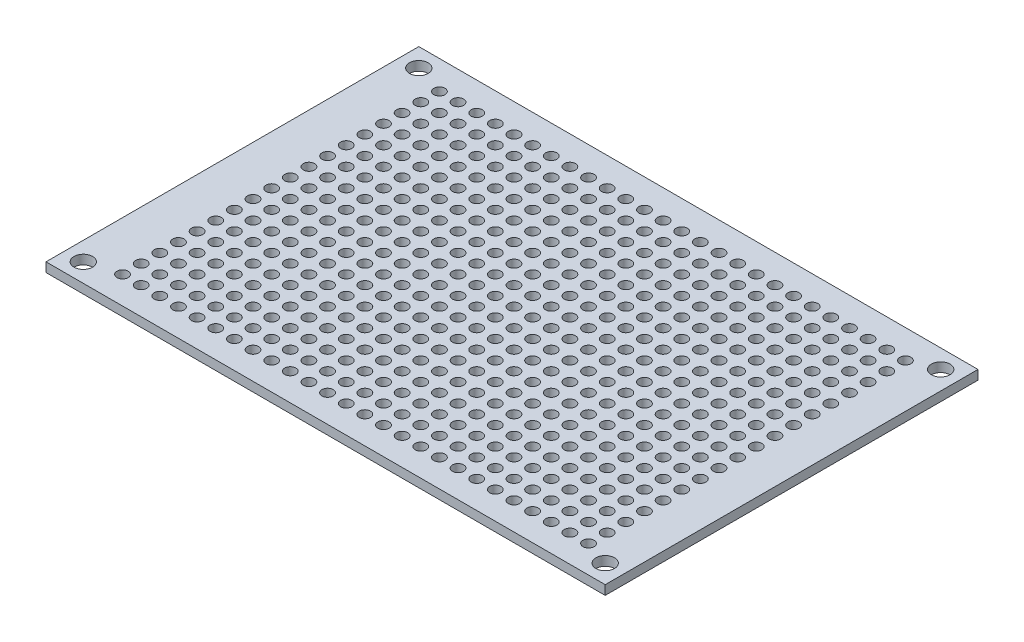
from build123d import *

# Parameters (mm, degrees)
SKETCH1_W           = 60
SKETCH1_H           = 40
SKETCH1_R           = 1
SKETCH1_R_2         = 0.6
BOSS_EXTRUDE1_DEPTH = 1


with BuildPart() as part:
    # Sketch1 → Boss-Extrude1 (new body)
    with BuildSketch(Plane(origin=(0, 0, 0), x_dir=(1, 0, 0), z_dir=(0, 1, 0))):
        Rectangle(SKETCH1_W, SKETCH1_H)
        with Locations((-28, 18)):
            Circle(SKETCH1_R, mode=Mode.SUBTRACT)
        with Locations((28, 18)):
            Circle(SKETCH1_R, mode=Mode.SUBTRACT)
        with Locations((28, -18)):
            Circle(SKETCH1_R, mode=Mode.SUBTRACT)
        with Locations((-28, -18)):
            Circle(SKETCH1_R, mode=Mode.SUBTRACT)
        with Locations((-24.724821281, 16.936286828)):
            Circle(SKETCH1_R_2, mode=Mode.SUBTRACT)
        with Locations((-22.724821281, 16.936286828)):
            Circle(SKETCH1_R_2, mode=Mode.SUBTRACT)
        with Locations((-20.724821281, 16.936286828)):
            Circle(SKETCH1_R_2, mode=Mode.SUBTRACT)
        with Locations((-18.724821281, 16.936286828)):
            Circle(SKETCH1_R_2, mode=Mode.SUBTRACT)
        with Locations((-16.724821281, 16.936286828)):
            Circle(SKETCH1_R_2, mode=Mode.SUBTRACT)
        with Locations((-14.724821281, 16.936286828)):
            Circle(SKETCH1_R_2, mode=Mode.SUBTRACT)
        with Locations((-12.724821281, 16.936286828)):
            Circle(SKETCH1_R_2, mode=Mode.SUBTRACT)
        with Locations((-10.724821281, 16.936286828)):
            Circle(SKETCH1_R_2, mode=Mode.SUBTRACT)
        with Locations((-8.724821281, 16.936286828)):
            Circle(SKETCH1_R_2, mode=Mode.SUBTRACT)
        with Locations((-6.724821281, 16.936286828)):
            Circle(SKETCH1_R_2, mode=Mode.SUBTRACT)
        with Locations((-4.724821281, 16.936286828)):
            Circle(SKETCH1_R_2, mode=Mode.SUBTRACT)
        with Locations((-2.724821281, 16.936286828)):
            Circle(SKETCH1_R_2, mode=Mode.SUBTRACT)
        with Locations((-0.724821281, 16.936286828)):
            Circle(SKETCH1_R_2, mode=Mode.SUBTRACT)
        with Locations((1.275178719, 16.936286828)):
            Circle(SKETCH1_R_2, mode=Mode.SUBTRACT)
        with Locations((3.275178719, 16.936286828)):
            Circle(SKETCH1_R_2, mode=Mode.SUBTRACT)
        with Locations((5.275178719, 16.936286828)):
            Circle(SKETCH1_R_2, mode=Mode.SUBTRACT)
        with Locations((7.275178719, 16.936286828)):
            Circle(SKETCH1_R_2, mode=Mode.SUBTRACT)
        with Locations((9.275178719, 16.936286828)):
            Circle(SKETCH1_R_2, mode=Mode.SUBTRACT)
        with Locations((11.275178719, 16.936286828)):
            Circle(SKETCH1_R_2, mode=Mode.SUBTRACT)
        with Locations((13.275178719, 16.936286828)):
            Circle(SKETCH1_R_2, mode=Mode.SUBTRACT)
        with Locations((15.275178719, 16.936286828)):
            Circle(SKETCH1_R_2, mode=Mode.SUBTRACT)
        with Locations((17.275178719, 16.936286828)):
            Circle(SKETCH1_R_2, mode=Mode.SUBTRACT)
        with Locations((19.275178719, 16.936286828)):
            Circle(SKETCH1_R_2, mode=Mode.SUBTRACT)
        with Locations((21.275178719, 16.936286828)):
            Circle(SKETCH1_R_2, mode=Mode.SUBTRACT)
        with Locations((23.275178719, 16.936286828)):
            Circle(SKETCH1_R_2, mode=Mode.SUBTRACT)
        with Locations((25.275178719, 16.936286828)):
            Circle(SKETCH1_R_2, mode=Mode.SUBTRACT)
        with Locations((-22.724821281, 14.936286828)):
            Circle(SKETCH1_R_2, mode=Mode.SUBTRACT)
        with Locations((-20.724821281, 14.936286828)):
            Circle(SKETCH1_R_2, mode=Mode.SUBTRACT)
        with Locations((-18.724821281, 14.936286828)):
            Circle(SKETCH1_R_2, mode=Mode.SUBTRACT)
        with Locations((-16.724821281, 14.936286828)):
            Circle(SKETCH1_R_2, mode=Mode.SUBTRACT)
        with Locations((-14.724821281, 14.936286828)):
            Circle(SKETCH1_R_2, mode=Mode.SUBTRACT)
        with Locations((-12.724821281, 14.936286828)):
            Circle(SKETCH1_R_2, mode=Mode.SUBTRACT)
        with Locations((-10.724821281, 14.936286828)):
            Circle(SKETCH1_R_2, mode=Mode.SUBTRACT)
        with Locations((-8.724821281, 14.936286828)):
            Circle(SKETCH1_R_2, mode=Mode.SUBTRACT)
        with Locations((-6.724821281, 14.936286828)):
            Circle(SKETCH1_R_2, mode=Mode.SUBTRACT)
        with Locations((-4.724821281, 14.936286828)):
            Circle(SKETCH1_R_2, mode=Mode.SUBTRACT)
        with Locations((-2.724821281, 14.936286828)):
            Circle(SKETCH1_R_2, mode=Mode.SUBTRACT)
        with Locations((-0.724821281, 14.936286828)):
            Circle(SKETCH1_R_2, mode=Mode.SUBTRACT)
        with Locations((1.275178719, 14.936286828)):
            Circle(SKETCH1_R_2, mode=Mode.SUBTRACT)
        with Locations((3.275178719, 14.936286828)):
            Circle(SKETCH1_R_2, mode=Mode.SUBTRACT)
        with Locations((5.275178719, 14.936286828)):
            Circle(SKETCH1_R_2, mode=Mode.SUBTRACT)
        with Locations((7.275178719, 14.936286828)):
            Circle(SKETCH1_R_2, mode=Mode.SUBTRACT)
        with Locations((9.275178719, 14.936286828)):
            Circle(SKETCH1_R_2, mode=Mode.SUBTRACT)
        with Locations((11.275178719, 14.936286828)):
            Circle(SKETCH1_R_2, mode=Mode.SUBTRACT)
        with Locations((13.275178719, 14.936286828)):
            Circle(SKETCH1_R_2, mode=Mode.SUBTRACT)
        with Locations((15.275178719, 14.936286828)):
            Circle(SKETCH1_R_2, mode=Mode.SUBTRACT)
        with Locations((17.275178719, 14.936286828)):
            Circle(SKETCH1_R_2, mode=Mode.SUBTRACT)
        with Locations((19.275178719, 14.936286828)):
            Circle(SKETCH1_R_2, mode=Mode.SUBTRACT)
        with Locations((21.275178719, 14.936286828)):
            Circle(SKETCH1_R_2, mode=Mode.SUBTRACT)
        with Locations((23.275178719, 14.936286828)):
            Circle(SKETCH1_R_2, mode=Mode.SUBTRACT)
        with Locations((25.275178719, 14.936286828)):
            Circle(SKETCH1_R_2, mode=Mode.SUBTRACT)
        with Locations((-22.724821281, 12.936286828)):
            Circle(SKETCH1_R_2, mode=Mode.SUBTRACT)
        with Locations((-20.724821281, 12.936286828)):
            Circle(SKETCH1_R_2, mode=Mode.SUBTRACT)
        with Locations((-18.724821281, 12.936286828)):
            Circle(SKETCH1_R_2, mode=Mode.SUBTRACT)
        with Locations((-16.724821281, 12.936286828)):
            Circle(SKETCH1_R_2, mode=Mode.SUBTRACT)
        with Locations((-14.724821281, 12.936286828)):
            Circle(SKETCH1_R_2, mode=Mode.SUBTRACT)
        with Locations((-12.724821281, 12.936286828)):
            Circle(SKETCH1_R_2, mode=Mode.SUBTRACT)
        with Locations((-10.724821281, 12.936286828)):
            Circle(SKETCH1_R_2, mode=Mode.SUBTRACT)
        with Locations((-8.724821281, 12.936286828)):
            Circle(SKETCH1_R_2, mode=Mode.SUBTRACT)
        with Locations((-6.724821281, 12.936286828)):
            Circle(SKETCH1_R_2, mode=Mode.SUBTRACT)
        with Locations((-4.724821281, 12.936286828)):
            Circle(SKETCH1_R_2, mode=Mode.SUBTRACT)
        with Locations((-2.724821281, 12.936286828)):
            Circle(SKETCH1_R_2, mode=Mode.SUBTRACT)
        with Locations((-0.724821281, 12.936286828)):
            Circle(SKETCH1_R_2, mode=Mode.SUBTRACT)
        with Locations((1.275178719, 12.936286828)):
            Circle(SKETCH1_R_2, mode=Mode.SUBTRACT)
        with Locations((3.275178719, 12.936286828)):
            Circle(SKETCH1_R_2, mode=Mode.SUBTRACT)
        with Locations((5.275178719, 12.936286828)):
            Circle(SKETCH1_R_2, mode=Mode.SUBTRACT)
        with Locations((7.275178719, 12.936286828)):
            Circle(SKETCH1_R_2, mode=Mode.SUBTRACT)
        with Locations((9.275178719, 12.936286828)):
            Circle(SKETCH1_R_2, mode=Mode.SUBTRACT)
        with Locations((11.275178719, 12.936286828)):
            Circle(SKETCH1_R_2, mode=Mode.SUBTRACT)
        with Locations((13.275178719, 12.936286828)):
            Circle(SKETCH1_R_2, mode=Mode.SUBTRACT)
        with Locations((15.275178719, 12.936286828)):
            Circle(SKETCH1_R_2, mode=Mode.SUBTRACT)
        with Locations((17.275178719, 12.936286828)):
            Circle(SKETCH1_R_2, mode=Mode.SUBTRACT)
        with Locations((19.275178719, 12.936286828)):
            Circle(SKETCH1_R_2, mode=Mode.SUBTRACT)
        with Locations((21.275178719, 12.936286828)):
            Circle(SKETCH1_R_2, mode=Mode.SUBTRACT)
        with Locations((23.275178719, 12.936286828)):
            Circle(SKETCH1_R_2, mode=Mode.SUBTRACT)
        with Locations((25.275178719, 12.936286828)):
            Circle(SKETCH1_R_2, mode=Mode.SUBTRACT)
        with Locations((-22.724821281, 10.936286828)):
            Circle(SKETCH1_R_2, mode=Mode.SUBTRACT)
        with Locations((-20.724821281, 10.936286828)):
            Circle(SKETCH1_R_2, mode=Mode.SUBTRACT)
        with Locations((-18.724821281, 10.936286828)):
            Circle(SKETCH1_R_2, mode=Mode.SUBTRACT)
        with Locations((-16.724821281, 10.936286828)):
            Circle(SKETCH1_R_2, mode=Mode.SUBTRACT)
        with Locations((-14.724821281, 10.936286828)):
            Circle(SKETCH1_R_2, mode=Mode.SUBTRACT)
        with Locations((-12.724821281, 10.936286828)):
            Circle(SKETCH1_R_2, mode=Mode.SUBTRACT)
        with Locations((-10.724821281, 10.936286828)):
            Circle(SKETCH1_R_2, mode=Mode.SUBTRACT)
        with Locations((-8.724821281, 10.936286828)):
            Circle(SKETCH1_R_2, mode=Mode.SUBTRACT)
        with Locations((-6.724821281, 10.936286828)):
            Circle(SKETCH1_R_2, mode=Mode.SUBTRACT)
        with Locations((-4.724821281, 10.936286828)):
            Circle(SKETCH1_R_2, mode=Mode.SUBTRACT)
        with Locations((-2.724821281, 10.936286828)):
            Circle(SKETCH1_R_2, mode=Mode.SUBTRACT)
        with Locations((-0.724821281, 10.936286828)):
            Circle(SKETCH1_R_2, mode=Mode.SUBTRACT)
        with Locations((1.275178719, 10.936286828)):
            Circle(SKETCH1_R_2, mode=Mode.SUBTRACT)
        with Locations((3.275178719, 10.936286828)):
            Circle(SKETCH1_R_2, mode=Mode.SUBTRACT)
        with Locations((5.275178719, 10.936286828)):
            Circle(SKETCH1_R_2, mode=Mode.SUBTRACT)
        with Locations((7.275178719, 10.936286828)):
            Circle(SKETCH1_R_2, mode=Mode.SUBTRACT)
        with Locations((9.275178719, 10.936286828)):
            Circle(SKETCH1_R_2, mode=Mode.SUBTRACT)
        with Locations((11.275178719, 10.936286828)):
            Circle(SKETCH1_R_2, mode=Mode.SUBTRACT)
        with Locations((13.275178719, 10.936286828)):
            Circle(SKETCH1_R_2, mode=Mode.SUBTRACT)
        with Locations((15.275178719, 10.936286828)):
            Circle(SKETCH1_R_2, mode=Mode.SUBTRACT)
        with Locations((17.275178719, 10.936286828)):
            Circle(SKETCH1_R_2, mode=Mode.SUBTRACT)
        with Locations((19.275178719, 10.936286828)):
            Circle(SKETCH1_R_2, mode=Mode.SUBTRACT)
        with Locations((21.275178719, 10.936286828)):
            Circle(SKETCH1_R_2, mode=Mode.SUBTRACT)
        with Locations((23.275178719, 10.936286828)):
            Circle(SKETCH1_R_2, mode=Mode.SUBTRACT)
        with Locations((25.275178719, 10.936286828)):
            Circle(SKETCH1_R_2, mode=Mode.SUBTRACT)
        with Locations((-22.724821281, 8.936286828)):
            Circle(SKETCH1_R_2, mode=Mode.SUBTRACT)
        with Locations((-20.724821281, 8.936286828)):
            Circle(SKETCH1_R_2, mode=Mode.SUBTRACT)
        with Locations((-18.724821281, 8.936286828)):
            Circle(SKETCH1_R_2, mode=Mode.SUBTRACT)
        with Locations((-16.724821281, 8.936286828)):
            Circle(SKETCH1_R_2, mode=Mode.SUBTRACT)
        with Locations((-14.724821281, 8.936286828)):
            Circle(SKETCH1_R_2, mode=Mode.SUBTRACT)
        with Locations((-12.724821281, 8.936286828)):
            Circle(SKETCH1_R_2, mode=Mode.SUBTRACT)
        with Locations((-10.724821281, 8.936286828)):
            Circle(SKETCH1_R_2, mode=Mode.SUBTRACT)
        with Locations((-8.724821281, 8.936286828)):
            Circle(SKETCH1_R_2, mode=Mode.SUBTRACT)
        with Locations((-6.724821281, 8.936286828)):
            Circle(SKETCH1_R_2, mode=Mode.SUBTRACT)
        with Locations((-4.724821281, 8.936286828)):
            Circle(SKETCH1_R_2, mode=Mode.SUBTRACT)
        with Locations((-2.724821281, 8.936286828)):
            Circle(SKETCH1_R_2, mode=Mode.SUBTRACT)
        with Locations((-0.724821281, 8.936286828)):
            Circle(SKETCH1_R_2, mode=Mode.SUBTRACT)
        with Locations((1.275178719, 8.936286828)):
            Circle(SKETCH1_R_2, mode=Mode.SUBTRACT)
        with Locations((3.275178719, 8.936286828)):
            Circle(SKETCH1_R_2, mode=Mode.SUBTRACT)
        with Locations((5.275178719, 8.936286828)):
            Circle(SKETCH1_R_2, mode=Mode.SUBTRACT)
        with Locations((7.275178719, 8.936286828)):
            Circle(SKETCH1_R_2, mode=Mode.SUBTRACT)
        with Locations((9.275178719, 8.936286828)):
            Circle(SKETCH1_R_2, mode=Mode.SUBTRACT)
        with Locations((11.275178719, 8.936286828)):
            Circle(SKETCH1_R_2, mode=Mode.SUBTRACT)
        with Locations((13.275178719, 8.936286828)):
            Circle(SKETCH1_R_2, mode=Mode.SUBTRACT)
        with Locations((15.275178719, 8.936286828)):
            Circle(SKETCH1_R_2, mode=Mode.SUBTRACT)
        with Locations((17.275178719, 8.936286828)):
            Circle(SKETCH1_R_2, mode=Mode.SUBTRACT)
        with Locations((19.275178719, 8.936286828)):
            Circle(SKETCH1_R_2, mode=Mode.SUBTRACT)
        with Locations((21.275178719, 8.936286828)):
            Circle(SKETCH1_R_2, mode=Mode.SUBTRACT)
        with Locations((23.275178719, 8.936286828)):
            Circle(SKETCH1_R_2, mode=Mode.SUBTRACT)
        with Locations((25.275178719, 8.936286828)):
            Circle(SKETCH1_R_2, mode=Mode.SUBTRACT)
        with Locations((-22.724821281, 6.936286828)):
            Circle(SKETCH1_R_2, mode=Mode.SUBTRACT)
        with Locations((-20.724821281, 6.936286828)):
            Circle(SKETCH1_R_2, mode=Mode.SUBTRACT)
        with Locations((-18.724821281, 6.936286828)):
            Circle(SKETCH1_R_2, mode=Mode.SUBTRACT)
        with Locations((-16.724821281, 6.936286828)):
            Circle(SKETCH1_R_2, mode=Mode.SUBTRACT)
        with Locations((-14.724821281, 6.936286828)):
            Circle(SKETCH1_R_2, mode=Mode.SUBTRACT)
        with Locations((-12.724821281, 6.936286828)):
            Circle(SKETCH1_R_2, mode=Mode.SUBTRACT)
        with Locations((-10.724821281, 6.936286828)):
            Circle(SKETCH1_R_2, mode=Mode.SUBTRACT)
        with Locations((-8.724821281, 6.936286828)):
            Circle(SKETCH1_R_2, mode=Mode.SUBTRACT)
        with Locations((-6.724821281, 6.936286828)):
            Circle(SKETCH1_R_2, mode=Mode.SUBTRACT)
        with Locations((-4.724821281, 6.936286828)):
            Circle(SKETCH1_R_2, mode=Mode.SUBTRACT)
        with Locations((-2.724821281, 6.936286828)):
            Circle(SKETCH1_R_2, mode=Mode.SUBTRACT)
        with Locations((-0.724821281, 6.936286828)):
            Circle(SKETCH1_R_2, mode=Mode.SUBTRACT)
        with Locations((1.275178719, 6.936286828)):
            Circle(SKETCH1_R_2, mode=Mode.SUBTRACT)
        with Locations((3.275178719, 6.936286828)):
            Circle(SKETCH1_R_2, mode=Mode.SUBTRACT)
        with Locations((5.275178719, 6.936286828)):
            Circle(SKETCH1_R_2, mode=Mode.SUBTRACT)
        with Locations((7.275178719, 6.936286828)):
            Circle(SKETCH1_R_2, mode=Mode.SUBTRACT)
        with Locations((9.275178719, 6.936286828)):
            Circle(SKETCH1_R_2, mode=Mode.SUBTRACT)
        with Locations((11.275178719, 6.936286828)):
            Circle(SKETCH1_R_2, mode=Mode.SUBTRACT)
        with Locations((13.275178719, 6.936286828)):
            Circle(SKETCH1_R_2, mode=Mode.SUBTRACT)
        with Locations((15.275178719, 6.936286828)):
            Circle(SKETCH1_R_2, mode=Mode.SUBTRACT)
        with Locations((17.275178719, 6.936286828)):
            Circle(SKETCH1_R_2, mode=Mode.SUBTRACT)
        with Locations((19.275178719, 6.936286828)):
            Circle(SKETCH1_R_2, mode=Mode.SUBTRACT)
        with Locations((21.275178719, 6.936286828)):
            Circle(SKETCH1_R_2, mode=Mode.SUBTRACT)
        with Locations((23.275178719, 6.936286828)):
            Circle(SKETCH1_R_2, mode=Mode.SUBTRACT)
        with Locations((25.275178719, 6.936286828)):
            Circle(SKETCH1_R_2, mode=Mode.SUBTRACT)
        with Locations((-22.724821281, 4.936286828)):
            Circle(SKETCH1_R_2, mode=Mode.SUBTRACT)
        with Locations((-20.724821281, 4.936286828)):
            Circle(SKETCH1_R_2, mode=Mode.SUBTRACT)
        with Locations((-18.724821281, 4.936286828)):
            Circle(SKETCH1_R_2, mode=Mode.SUBTRACT)
        with Locations((-16.724821281, 4.936286828)):
            Circle(SKETCH1_R_2, mode=Mode.SUBTRACT)
        with Locations((-14.724821281, 4.936286828)):
            Circle(SKETCH1_R_2, mode=Mode.SUBTRACT)
        with Locations((-12.724821281, 4.936286828)):
            Circle(SKETCH1_R_2, mode=Mode.SUBTRACT)
        with Locations((-10.724821281, 4.936286828)):
            Circle(SKETCH1_R_2, mode=Mode.SUBTRACT)
        with Locations((-8.724821281, 4.936286828)):
            Circle(SKETCH1_R_2, mode=Mode.SUBTRACT)
        with Locations((-6.724821281, 4.936286828)):
            Circle(SKETCH1_R_2, mode=Mode.SUBTRACT)
        with Locations((-4.724821281, 4.936286828)):
            Circle(SKETCH1_R_2, mode=Mode.SUBTRACT)
        with Locations((-2.724821281, 4.936286828)):
            Circle(SKETCH1_R_2, mode=Mode.SUBTRACT)
        with Locations((-0.724821281, 4.936286828)):
            Circle(SKETCH1_R_2, mode=Mode.SUBTRACT)
        with Locations((1.275178719, 4.936286828)):
            Circle(SKETCH1_R_2, mode=Mode.SUBTRACT)
        with Locations((3.275178719, 4.936286828)):
            Circle(SKETCH1_R_2, mode=Mode.SUBTRACT)
        with Locations((5.275178719, 4.936286828)):
            Circle(SKETCH1_R_2, mode=Mode.SUBTRACT)
        with Locations((7.275178719, 4.936286828)):
            Circle(SKETCH1_R_2, mode=Mode.SUBTRACT)
        with Locations((9.275178719, 4.936286828)):
            Circle(SKETCH1_R_2, mode=Mode.SUBTRACT)
        with Locations((11.275178719, 4.936286828)):
            Circle(SKETCH1_R_2, mode=Mode.SUBTRACT)
        with Locations((13.275178719, 4.936286828)):
            Circle(SKETCH1_R_2, mode=Mode.SUBTRACT)
        with Locations((15.275178719, 4.936286828)):
            Circle(SKETCH1_R_2, mode=Mode.SUBTRACT)
        with Locations((17.275178719, 4.936286828)):
            Circle(SKETCH1_R_2, mode=Mode.SUBTRACT)
        with Locations((19.275178719, 4.936286828)):
            Circle(SKETCH1_R_2, mode=Mode.SUBTRACT)
        with Locations((21.275178719, 4.936286828)):
            Circle(SKETCH1_R_2, mode=Mode.SUBTRACT)
        with Locations((23.275178719, 4.936286828)):
            Circle(SKETCH1_R_2, mode=Mode.SUBTRACT)
        with Locations((25.275178719, 4.936286828)):
            Circle(SKETCH1_R_2, mode=Mode.SUBTRACT)
        with Locations((-22.724821281, 2.936286828)):
            Circle(SKETCH1_R_2, mode=Mode.SUBTRACT)
        with Locations((-20.724821281, 2.936286828)):
            Circle(SKETCH1_R_2, mode=Mode.SUBTRACT)
        with Locations((-18.724821281, 2.936286828)):
            Circle(SKETCH1_R_2, mode=Mode.SUBTRACT)
        with Locations((-16.724821281, 2.936286828)):
            Circle(SKETCH1_R_2, mode=Mode.SUBTRACT)
        with Locations((-14.724821281, 2.936286828)):
            Circle(SKETCH1_R_2, mode=Mode.SUBTRACT)
        with Locations((-12.724821281, 2.936286828)):
            Circle(SKETCH1_R_2, mode=Mode.SUBTRACT)
        with Locations((-10.724821281, 2.936286828)):
            Circle(SKETCH1_R_2, mode=Mode.SUBTRACT)
        with Locations((-8.724821281, 2.936286828)):
            Circle(SKETCH1_R_2, mode=Mode.SUBTRACT)
        with Locations((-6.724821281, 2.936286828)):
            Circle(SKETCH1_R_2, mode=Mode.SUBTRACT)
        with Locations((-4.724821281, 2.936286828)):
            Circle(SKETCH1_R_2, mode=Mode.SUBTRACT)
        with Locations((-2.724821281, 2.936286828)):
            Circle(SKETCH1_R_2, mode=Mode.SUBTRACT)
        with Locations((-0.724821281, 2.936286828)):
            Circle(SKETCH1_R_2, mode=Mode.SUBTRACT)
        with Locations((1.275178719, 2.936286828)):
            Circle(SKETCH1_R_2, mode=Mode.SUBTRACT)
        with Locations((3.275178719, 2.936286828)):
            Circle(SKETCH1_R_2, mode=Mode.SUBTRACT)
        with Locations((5.275178719, 2.936286828)):
            Circle(SKETCH1_R_2, mode=Mode.SUBTRACT)
        with Locations((7.275178719, 2.936286828)):
            Circle(SKETCH1_R_2, mode=Mode.SUBTRACT)
        with Locations((9.275178719, 2.936286828)):
            Circle(SKETCH1_R_2, mode=Mode.SUBTRACT)
        with Locations((11.275178719, 2.936286828)):
            Circle(SKETCH1_R_2, mode=Mode.SUBTRACT)
        with Locations((13.275178719, 2.936286828)):
            Circle(SKETCH1_R_2, mode=Mode.SUBTRACT)
        with Locations((15.275178719, 2.936286828)):
            Circle(SKETCH1_R_2, mode=Mode.SUBTRACT)
        with Locations((17.275178719, 2.936286828)):
            Circle(SKETCH1_R_2, mode=Mode.SUBTRACT)
        with Locations((19.275178719, 2.936286828)):
            Circle(SKETCH1_R_2, mode=Mode.SUBTRACT)
        with Locations((21.275178719, 2.936286828)):
            Circle(SKETCH1_R_2, mode=Mode.SUBTRACT)
        with Locations((23.275178719, 2.936286828)):
            Circle(SKETCH1_R_2, mode=Mode.SUBTRACT)
        with Locations((25.275178719, 2.936286828)):
            Circle(SKETCH1_R_2, mode=Mode.SUBTRACT)
        with Locations((-22.724821281, 0.936286828)):
            Circle(SKETCH1_R_2, mode=Mode.SUBTRACT)
        with Locations((-20.724821281, 0.936286828)):
            Circle(SKETCH1_R_2, mode=Mode.SUBTRACT)
        with Locations((-18.724821281, 0.936286828)):
            Circle(SKETCH1_R_2, mode=Mode.SUBTRACT)
        with Locations((-16.724821281, 0.936286828)):
            Circle(SKETCH1_R_2, mode=Mode.SUBTRACT)
        with Locations((-14.724821281, 0.936286828)):
            Circle(SKETCH1_R_2, mode=Mode.SUBTRACT)
        with Locations((-12.724821281, 0.936286828)):
            Circle(SKETCH1_R_2, mode=Mode.SUBTRACT)
        with Locations((-10.724821281, 0.936286828)):
            Circle(SKETCH1_R_2, mode=Mode.SUBTRACT)
        with Locations((-8.724821281, 0.936286828)):
            Circle(SKETCH1_R_2, mode=Mode.SUBTRACT)
        with Locations((-6.724821281, 0.936286828)):
            Circle(SKETCH1_R_2, mode=Mode.SUBTRACT)
        with Locations((-4.724821281, 0.936286828)):
            Circle(SKETCH1_R_2, mode=Mode.SUBTRACT)
        with Locations((-2.724821281, 0.936286828)):
            Circle(SKETCH1_R_2, mode=Mode.SUBTRACT)
        with Locations((-0.724821281, 0.936286828)):
            Circle(SKETCH1_R_2, mode=Mode.SUBTRACT)
        with Locations((1.275178719, 0.936286828)):
            Circle(SKETCH1_R_2, mode=Mode.SUBTRACT)
        with Locations((3.275178719, 0.936286828)):
            Circle(SKETCH1_R_2, mode=Mode.SUBTRACT)
        with Locations((5.275178719, 0.936286828)):
            Circle(SKETCH1_R_2, mode=Mode.SUBTRACT)
        with Locations((7.275178719, 0.936286828)):
            Circle(SKETCH1_R_2, mode=Mode.SUBTRACT)
        with Locations((9.275178719, 0.936286828)):
            Circle(SKETCH1_R_2, mode=Mode.SUBTRACT)
        with Locations((11.275178719, 0.936286828)):
            Circle(SKETCH1_R_2, mode=Mode.SUBTRACT)
        with Locations((13.275178719, 0.936286828)):
            Circle(SKETCH1_R_2, mode=Mode.SUBTRACT)
        with Locations((15.275178719, 0.936286828)):
            Circle(SKETCH1_R_2, mode=Mode.SUBTRACT)
        with Locations((17.275178719, 0.936286828)):
            Circle(SKETCH1_R_2, mode=Mode.SUBTRACT)
        with Locations((19.275178719, 0.936286828)):
            Circle(SKETCH1_R_2, mode=Mode.SUBTRACT)
        with Locations((21.275178719, 0.936286828)):
            Circle(SKETCH1_R_2, mode=Mode.SUBTRACT)
        with Locations((23.275178719, 0.936286828)):
            Circle(SKETCH1_R_2, mode=Mode.SUBTRACT)
        with Locations((25.275178719, 0.936286828)):
            Circle(SKETCH1_R_2, mode=Mode.SUBTRACT)
        with Locations((-22.724821281, -1.063713172)):
            Circle(SKETCH1_R_2, mode=Mode.SUBTRACT)
        with Locations((-20.724821281, -1.063713172)):
            Circle(SKETCH1_R_2, mode=Mode.SUBTRACT)
        with Locations((-18.724821281, -1.063713172)):
            Circle(SKETCH1_R_2, mode=Mode.SUBTRACT)
        with Locations((-16.724821281, -1.063713172)):
            Circle(SKETCH1_R_2, mode=Mode.SUBTRACT)
        with Locations((-14.724821281, -1.063713172)):
            Circle(SKETCH1_R_2, mode=Mode.SUBTRACT)
        with Locations((-12.724821281, -1.063713172)):
            Circle(SKETCH1_R_2, mode=Mode.SUBTRACT)
        with Locations((-10.724821281, -1.063713172)):
            Circle(SKETCH1_R_2, mode=Mode.SUBTRACT)
        with Locations((-8.724821281, -1.063713172)):
            Circle(SKETCH1_R_2, mode=Mode.SUBTRACT)
        with Locations((-6.724821281, -1.063713172)):
            Circle(SKETCH1_R_2, mode=Mode.SUBTRACT)
        with Locations((-4.724821281, -1.063713172)):
            Circle(SKETCH1_R_2, mode=Mode.SUBTRACT)
        with Locations((-2.724821281, -1.063713172)):
            Circle(SKETCH1_R_2, mode=Mode.SUBTRACT)
        with Locations((-0.724821281, -1.063713172)):
            Circle(SKETCH1_R_2, mode=Mode.SUBTRACT)
        with Locations((1.275178719, -1.063713172)):
            Circle(SKETCH1_R_2, mode=Mode.SUBTRACT)
        with Locations((3.275178719, -1.063713172)):
            Circle(SKETCH1_R_2, mode=Mode.SUBTRACT)
        with Locations((5.275178719, -1.063713172)):
            Circle(SKETCH1_R_2, mode=Mode.SUBTRACT)
        with Locations((7.275178719, -1.063713172)):
            Circle(SKETCH1_R_2, mode=Mode.SUBTRACT)
        with Locations((9.275178719, -1.063713172)):
            Circle(SKETCH1_R_2, mode=Mode.SUBTRACT)
        with Locations((11.275178719, -1.063713172)):
            Circle(SKETCH1_R_2, mode=Mode.SUBTRACT)
        with Locations((13.275178719, -1.063713172)):
            Circle(SKETCH1_R_2, mode=Mode.SUBTRACT)
        with Locations((15.275178719, -1.063713172)):
            Circle(SKETCH1_R_2, mode=Mode.SUBTRACT)
        with Locations((17.275178719, -1.063713172)):
            Circle(SKETCH1_R_2, mode=Mode.SUBTRACT)
        with Locations((19.275178719, -1.063713172)):
            Circle(SKETCH1_R_2, mode=Mode.SUBTRACT)
        with Locations((21.275178719, -1.063713172)):
            Circle(SKETCH1_R_2, mode=Mode.SUBTRACT)
        with Locations((23.275178719, -1.063713172)):
            Circle(SKETCH1_R_2, mode=Mode.SUBTRACT)
        with Locations((25.275178719, -1.063713172)):
            Circle(SKETCH1_R_2, mode=Mode.SUBTRACT)
        with Locations((-22.724821281, -3.063713172)):
            Circle(SKETCH1_R_2, mode=Mode.SUBTRACT)
        with Locations((-20.724821281, -3.063713172)):
            Circle(SKETCH1_R_2, mode=Mode.SUBTRACT)
        with Locations((-18.724821281, -3.063713172)):
            Circle(SKETCH1_R_2, mode=Mode.SUBTRACT)
        with Locations((-16.724821281, -3.063713172)):
            Circle(SKETCH1_R_2, mode=Mode.SUBTRACT)
        with Locations((-14.724821281, -3.063713172)):
            Circle(SKETCH1_R_2, mode=Mode.SUBTRACT)
        with Locations((-12.724821281, -3.063713172)):
            Circle(SKETCH1_R_2, mode=Mode.SUBTRACT)
        with Locations((-10.724821281, -3.063713172)):
            Circle(SKETCH1_R_2, mode=Mode.SUBTRACT)
        with Locations((-8.724821281, -3.063713172)):
            Circle(SKETCH1_R_2, mode=Mode.SUBTRACT)
        with Locations((-6.724821281, -3.063713172)):
            Circle(SKETCH1_R_2, mode=Mode.SUBTRACT)
        with Locations((-4.724821281, -3.063713172)):
            Circle(SKETCH1_R_2, mode=Mode.SUBTRACT)
        with Locations((-2.724821281, -3.063713172)):
            Circle(SKETCH1_R_2, mode=Mode.SUBTRACT)
        with Locations((-0.724821281, -3.063713172)):
            Circle(SKETCH1_R_2, mode=Mode.SUBTRACT)
        with Locations((1.275178719, -3.063713172)):
            Circle(SKETCH1_R_2, mode=Mode.SUBTRACT)
        with Locations((3.275178719, -3.063713172)):
            Circle(SKETCH1_R_2, mode=Mode.SUBTRACT)
        with Locations((5.275178719, -3.063713172)):
            Circle(SKETCH1_R_2, mode=Mode.SUBTRACT)
        with Locations((7.275178719, -3.063713172)):
            Circle(SKETCH1_R_2, mode=Mode.SUBTRACT)
        with Locations((9.275178719, -3.063713172)):
            Circle(SKETCH1_R_2, mode=Mode.SUBTRACT)
        with Locations((11.275178719, -3.063713172)):
            Circle(SKETCH1_R_2, mode=Mode.SUBTRACT)
        with Locations((13.275178719, -3.063713172)):
            Circle(SKETCH1_R_2, mode=Mode.SUBTRACT)
        with Locations((15.275178719, -3.063713172)):
            Circle(SKETCH1_R_2, mode=Mode.SUBTRACT)
        with Locations((17.275178719, -3.063713172)):
            Circle(SKETCH1_R_2, mode=Mode.SUBTRACT)
        with Locations((19.275178719, -3.063713172)):
            Circle(SKETCH1_R_2, mode=Mode.SUBTRACT)
        with Locations((21.275178719, -3.063713172)):
            Circle(SKETCH1_R_2, mode=Mode.SUBTRACT)
        with Locations((23.275178719, -3.063713172)):
            Circle(SKETCH1_R_2, mode=Mode.SUBTRACT)
        with Locations((25.275178719, -3.063713172)):
            Circle(SKETCH1_R_2, mode=Mode.SUBTRACT)
        with Locations((-22.724821281, -5.063713172)):
            Circle(SKETCH1_R_2, mode=Mode.SUBTRACT)
        with Locations((-20.724821281, -5.063713172)):
            Circle(SKETCH1_R_2, mode=Mode.SUBTRACT)
        with Locations((-18.724821281, -5.063713172)):
            Circle(SKETCH1_R_2, mode=Mode.SUBTRACT)
        with Locations((-16.724821281, -5.063713172)):
            Circle(SKETCH1_R_2, mode=Mode.SUBTRACT)
        with Locations((-14.724821281, -5.063713172)):
            Circle(SKETCH1_R_2, mode=Mode.SUBTRACT)
        with Locations((-12.724821281, -5.063713172)):
            Circle(SKETCH1_R_2, mode=Mode.SUBTRACT)
        with Locations((-10.724821281, -5.063713172)):
            Circle(SKETCH1_R_2, mode=Mode.SUBTRACT)
        with Locations((-8.724821281, -5.063713172)):
            Circle(SKETCH1_R_2, mode=Mode.SUBTRACT)
        with Locations((-6.724821281, -5.063713172)):
            Circle(SKETCH1_R_2, mode=Mode.SUBTRACT)
        with Locations((-4.724821281, -5.063713172)):
            Circle(SKETCH1_R_2, mode=Mode.SUBTRACT)
        with Locations((-2.724821281, -5.063713172)):
            Circle(SKETCH1_R_2, mode=Mode.SUBTRACT)
        with Locations((-0.724821281, -5.063713172)):
            Circle(SKETCH1_R_2, mode=Mode.SUBTRACT)
        with Locations((1.275178719, -5.063713172)):
            Circle(SKETCH1_R_2, mode=Mode.SUBTRACT)
        with Locations((3.275178719, -5.063713172)):
            Circle(SKETCH1_R_2, mode=Mode.SUBTRACT)
        with Locations((5.275178719, -5.063713172)):
            Circle(SKETCH1_R_2, mode=Mode.SUBTRACT)
        with Locations((7.275178719, -5.063713172)):
            Circle(SKETCH1_R_2, mode=Mode.SUBTRACT)
        with Locations((9.275178719, -5.063713172)):
            Circle(SKETCH1_R_2, mode=Mode.SUBTRACT)
        with Locations((11.275178719, -5.063713172)):
            Circle(SKETCH1_R_2, mode=Mode.SUBTRACT)
        with Locations((13.275178719, -5.063713172)):
            Circle(SKETCH1_R_2, mode=Mode.SUBTRACT)
        with Locations((15.275178719, -5.063713172)):
            Circle(SKETCH1_R_2, mode=Mode.SUBTRACT)
        with Locations((17.275178719, -5.063713172)):
            Circle(SKETCH1_R_2, mode=Mode.SUBTRACT)
        with Locations((19.275178719, -5.063713172)):
            Circle(SKETCH1_R_2, mode=Mode.SUBTRACT)
        with Locations((21.275178719, -5.063713172)):
            Circle(SKETCH1_R_2, mode=Mode.SUBTRACT)
        with Locations((23.275178719, -5.063713172)):
            Circle(SKETCH1_R_2, mode=Mode.SUBTRACT)
        with Locations((25.275178719, -5.063713172)):
            Circle(SKETCH1_R_2, mode=Mode.SUBTRACT)
        with Locations((-22.724821281, -7.063713172)):
            Circle(SKETCH1_R_2, mode=Mode.SUBTRACT)
        with Locations((-20.724821281, -7.063713172)):
            Circle(SKETCH1_R_2, mode=Mode.SUBTRACT)
        with Locations((-18.724821281, -7.063713172)):
            Circle(SKETCH1_R_2, mode=Mode.SUBTRACT)
        with Locations((-16.724821281, -7.063713172)):
            Circle(SKETCH1_R_2, mode=Mode.SUBTRACT)
        with Locations((-14.724821281, -7.063713172)):
            Circle(SKETCH1_R_2, mode=Mode.SUBTRACT)
        with Locations((-12.724821281, -7.063713172)):
            Circle(SKETCH1_R_2, mode=Mode.SUBTRACT)
        with Locations((-10.724821281, -7.063713172)):
            Circle(SKETCH1_R_2, mode=Mode.SUBTRACT)
        with Locations((-8.724821281, -7.063713172)):
            Circle(SKETCH1_R_2, mode=Mode.SUBTRACT)
        with Locations((-6.724821281, -7.063713172)):
            Circle(SKETCH1_R_2, mode=Mode.SUBTRACT)
        with Locations((-4.724821281, -7.063713172)):
            Circle(SKETCH1_R_2, mode=Mode.SUBTRACT)
        with Locations((-2.724821281, -7.063713172)):
            Circle(SKETCH1_R_2, mode=Mode.SUBTRACT)
        with Locations((-0.724821281, -7.063713172)):
            Circle(SKETCH1_R_2, mode=Mode.SUBTRACT)
        with Locations((1.275178719, -7.063713172)):
            Circle(SKETCH1_R_2, mode=Mode.SUBTRACT)
        with Locations((3.275178719, -7.063713172)):
            Circle(SKETCH1_R_2, mode=Mode.SUBTRACT)
        with Locations((5.275178719, -7.063713172)):
            Circle(SKETCH1_R_2, mode=Mode.SUBTRACT)
        with Locations((7.275178719, -7.063713172)):
            Circle(SKETCH1_R_2, mode=Mode.SUBTRACT)
        with Locations((9.275178719, -7.063713172)):
            Circle(SKETCH1_R_2, mode=Mode.SUBTRACT)
        with Locations((11.275178719, -7.063713172)):
            Circle(SKETCH1_R_2, mode=Mode.SUBTRACT)
        with Locations((13.275178719, -7.063713172)):
            Circle(SKETCH1_R_2, mode=Mode.SUBTRACT)
        with Locations((15.275178719, -7.063713172)):
            Circle(SKETCH1_R_2, mode=Mode.SUBTRACT)
        with Locations((17.275178719, -7.063713172)):
            Circle(SKETCH1_R_2, mode=Mode.SUBTRACT)
        with Locations((19.275178719, -7.063713172)):
            Circle(SKETCH1_R_2, mode=Mode.SUBTRACT)
        with Locations((21.275178719, -7.063713172)):
            Circle(SKETCH1_R_2, mode=Mode.SUBTRACT)
        with Locations((23.275178719, -7.063713172)):
            Circle(SKETCH1_R_2, mode=Mode.SUBTRACT)
        with Locations((25.275178719, -7.063713172)):
            Circle(SKETCH1_R_2, mode=Mode.SUBTRACT)
        with Locations((-22.724821281, -9.063713172)):
            Circle(SKETCH1_R_2, mode=Mode.SUBTRACT)
        with Locations((-20.724821281, -9.063713172)):
            Circle(SKETCH1_R_2, mode=Mode.SUBTRACT)
        with Locations((-18.724821281, -9.063713172)):
            Circle(SKETCH1_R_2, mode=Mode.SUBTRACT)
        with Locations((-16.724821281, -9.063713172)):
            Circle(SKETCH1_R_2, mode=Mode.SUBTRACT)
        with Locations((-14.724821281, -9.063713172)):
            Circle(SKETCH1_R_2, mode=Mode.SUBTRACT)
        with Locations((-12.724821281, -9.063713172)):
            Circle(SKETCH1_R_2, mode=Mode.SUBTRACT)
        with Locations((-10.724821281, -9.063713172)):
            Circle(SKETCH1_R_2, mode=Mode.SUBTRACT)
        with Locations((-8.724821281, -9.063713172)):
            Circle(SKETCH1_R_2, mode=Mode.SUBTRACT)
        with Locations((-6.724821281, -9.063713172)):
            Circle(SKETCH1_R_2, mode=Mode.SUBTRACT)
        with Locations((-4.724821281, -9.063713172)):
            Circle(SKETCH1_R_2, mode=Mode.SUBTRACT)
        with Locations((-2.724821281, -9.063713172)):
            Circle(SKETCH1_R_2, mode=Mode.SUBTRACT)
        with Locations((-0.724821281, -9.063713172)):
            Circle(SKETCH1_R_2, mode=Mode.SUBTRACT)
        with Locations((1.275178719, -9.063713172)):
            Circle(SKETCH1_R_2, mode=Mode.SUBTRACT)
        with Locations((3.275178719, -9.063713172)):
            Circle(SKETCH1_R_2, mode=Mode.SUBTRACT)
        with Locations((5.275178719, -9.063713172)):
            Circle(SKETCH1_R_2, mode=Mode.SUBTRACT)
        with Locations((7.275178719, -9.063713172)):
            Circle(SKETCH1_R_2, mode=Mode.SUBTRACT)
        with Locations((9.275178719, -9.063713172)):
            Circle(SKETCH1_R_2, mode=Mode.SUBTRACT)
        with Locations((11.275178719, -9.063713172)):
            Circle(SKETCH1_R_2, mode=Mode.SUBTRACT)
        with Locations((13.275178719, -9.063713172)):
            Circle(SKETCH1_R_2, mode=Mode.SUBTRACT)
        with Locations((15.275178719, -9.063713172)):
            Circle(SKETCH1_R_2, mode=Mode.SUBTRACT)
        with Locations((17.275178719, -9.063713172)):
            Circle(SKETCH1_R_2, mode=Mode.SUBTRACT)
        with Locations((19.275178719, -9.063713172)):
            Circle(SKETCH1_R_2, mode=Mode.SUBTRACT)
        with Locations((21.275178719, -9.063713172)):
            Circle(SKETCH1_R_2, mode=Mode.SUBTRACT)
        with Locations((23.275178719, -9.063713172)):
            Circle(SKETCH1_R_2, mode=Mode.SUBTRACT)
        with Locations((25.275178719, -9.063713172)):
            Circle(SKETCH1_R_2, mode=Mode.SUBTRACT)
        with Locations((-22.724821281, -11.063713172)):
            Circle(SKETCH1_R_2, mode=Mode.SUBTRACT)
        with Locations((-20.724821281, -11.063713172)):
            Circle(SKETCH1_R_2, mode=Mode.SUBTRACT)
        with Locations((-18.724821281, -11.063713172)):
            Circle(SKETCH1_R_2, mode=Mode.SUBTRACT)
        with Locations((-16.724821281, -11.063713172)):
            Circle(SKETCH1_R_2, mode=Mode.SUBTRACT)
        with Locations((-14.724821281, -11.063713172)):
            Circle(SKETCH1_R_2, mode=Mode.SUBTRACT)
        with Locations((-12.724821281, -11.063713172)):
            Circle(SKETCH1_R_2, mode=Mode.SUBTRACT)
        with Locations((-10.724821281, -11.063713172)):
            Circle(SKETCH1_R_2, mode=Mode.SUBTRACT)
        with Locations((-8.724821281, -11.063713172)):
            Circle(SKETCH1_R_2, mode=Mode.SUBTRACT)
        with Locations((-6.724821281, -11.063713172)):
            Circle(SKETCH1_R_2, mode=Mode.SUBTRACT)
        with Locations((-4.724821281, -11.063713172)):
            Circle(SKETCH1_R_2, mode=Mode.SUBTRACT)
        with Locations((-2.724821281, -11.063713172)):
            Circle(SKETCH1_R_2, mode=Mode.SUBTRACT)
        with Locations((-0.724821281, -11.063713172)):
            Circle(SKETCH1_R_2, mode=Mode.SUBTRACT)
        with Locations((1.275178719, -11.063713172)):
            Circle(SKETCH1_R_2, mode=Mode.SUBTRACT)
        with Locations((3.275178719, -11.063713172)):
            Circle(SKETCH1_R_2, mode=Mode.SUBTRACT)
        with Locations((5.275178719, -11.063713172)):
            Circle(SKETCH1_R_2, mode=Mode.SUBTRACT)
        with Locations((7.275178719, -11.063713172)):
            Circle(SKETCH1_R_2, mode=Mode.SUBTRACT)
        with Locations((9.275178719, -11.063713172)):
            Circle(SKETCH1_R_2, mode=Mode.SUBTRACT)
        with Locations((11.275178719, -11.063713172)):
            Circle(SKETCH1_R_2, mode=Mode.SUBTRACT)
        with Locations((13.275178719, -11.063713172)):
            Circle(SKETCH1_R_2, mode=Mode.SUBTRACT)
        with Locations((15.275178719, -11.063713172)):
            Circle(SKETCH1_R_2, mode=Mode.SUBTRACT)
        with Locations((17.275178719, -11.063713172)):
            Circle(SKETCH1_R_2, mode=Mode.SUBTRACT)
        with Locations((19.275178719, -11.063713172)):
            Circle(SKETCH1_R_2, mode=Mode.SUBTRACT)
        with Locations((21.275178719, -11.063713172)):
            Circle(SKETCH1_R_2, mode=Mode.SUBTRACT)
        with Locations((23.275178719, -11.063713172)):
            Circle(SKETCH1_R_2, mode=Mode.SUBTRACT)
        with Locations((25.275178719, -11.063713172)):
            Circle(SKETCH1_R_2, mode=Mode.SUBTRACT)
        with Locations((-22.724821281, -13.063713172)):
            Circle(SKETCH1_R_2, mode=Mode.SUBTRACT)
        with Locations((-20.724821281, -13.063713172)):
            Circle(SKETCH1_R_2, mode=Mode.SUBTRACT)
        with Locations((-18.724821281, -13.063713172)):
            Circle(SKETCH1_R_2, mode=Mode.SUBTRACT)
        with Locations((-16.724821281, -13.063713172)):
            Circle(SKETCH1_R_2, mode=Mode.SUBTRACT)
        with Locations((-14.724821281, -13.063713172)):
            Circle(SKETCH1_R_2, mode=Mode.SUBTRACT)
        with Locations((-12.724821281, -13.063713172)):
            Circle(SKETCH1_R_2, mode=Mode.SUBTRACT)
        with Locations((-10.724821281, -13.063713172)):
            Circle(SKETCH1_R_2, mode=Mode.SUBTRACT)
        with Locations((-8.724821281, -13.063713172)):
            Circle(SKETCH1_R_2, mode=Mode.SUBTRACT)
        with Locations((-6.724821281, -13.063713172)):
            Circle(SKETCH1_R_2, mode=Mode.SUBTRACT)
        with Locations((-4.724821281, -13.063713172)):
            Circle(SKETCH1_R_2, mode=Mode.SUBTRACT)
        with Locations((-2.724821281, -13.063713172)):
            Circle(SKETCH1_R_2, mode=Mode.SUBTRACT)
        with Locations((-0.724821281, -13.063713172)):
            Circle(SKETCH1_R_2, mode=Mode.SUBTRACT)
        with Locations((1.275178719, -13.063713172)):
            Circle(SKETCH1_R_2, mode=Mode.SUBTRACT)
        with Locations((3.275178719, -13.063713172)):
            Circle(SKETCH1_R_2, mode=Mode.SUBTRACT)
        with Locations((5.275178719, -13.063713172)):
            Circle(SKETCH1_R_2, mode=Mode.SUBTRACT)
        with Locations((7.275178719, -13.063713172)):
            Circle(SKETCH1_R_2, mode=Mode.SUBTRACT)
        with Locations((9.275178719, -13.063713172)):
            Circle(SKETCH1_R_2, mode=Mode.SUBTRACT)
        with Locations((11.275178719, -13.063713172)):
            Circle(SKETCH1_R_2, mode=Mode.SUBTRACT)
        with Locations((13.275178719, -13.063713172)):
            Circle(SKETCH1_R_2, mode=Mode.SUBTRACT)
        with Locations((15.275178719, -13.063713172)):
            Circle(SKETCH1_R_2, mode=Mode.SUBTRACT)
        with Locations((17.275178719, -13.063713172)):
            Circle(SKETCH1_R_2, mode=Mode.SUBTRACT)
        with Locations((19.275178719, -13.063713172)):
            Circle(SKETCH1_R_2, mode=Mode.SUBTRACT)
        with Locations((21.275178719, -13.063713172)):
            Circle(SKETCH1_R_2, mode=Mode.SUBTRACT)
        with Locations((23.275178719, -13.063713172)):
            Circle(SKETCH1_R_2, mode=Mode.SUBTRACT)
        with Locations((25.275178719, -13.063713172)):
            Circle(SKETCH1_R_2, mode=Mode.SUBTRACT)
        with Locations((-22.724821281, -15.063713172)):
            Circle(SKETCH1_R_2, mode=Mode.SUBTRACT)
        with Locations((-20.724821281, -15.063713172)):
            Circle(SKETCH1_R_2, mode=Mode.SUBTRACT)
        with Locations((-18.724821281, -15.063713172)):
            Circle(SKETCH1_R_2, mode=Mode.SUBTRACT)
        with Locations((-16.724821281, -15.063713172)):
            Circle(SKETCH1_R_2, mode=Mode.SUBTRACT)
        with Locations((-14.724821281, -15.063713172)):
            Circle(SKETCH1_R_2, mode=Mode.SUBTRACT)
        with Locations((-12.724821281, -15.063713172)):
            Circle(SKETCH1_R_2, mode=Mode.SUBTRACT)
        with Locations((-10.724821281, -15.063713172)):
            Circle(SKETCH1_R_2, mode=Mode.SUBTRACT)
        with Locations((-8.724821281, -15.063713172)):
            Circle(SKETCH1_R_2, mode=Mode.SUBTRACT)
        with Locations((-6.724821281, -15.063713172)):
            Circle(SKETCH1_R_2, mode=Mode.SUBTRACT)
        with Locations((-4.724821281, -15.063713172)):
            Circle(SKETCH1_R_2, mode=Mode.SUBTRACT)
        with Locations((-2.724821281, -15.063713172)):
            Circle(SKETCH1_R_2, mode=Mode.SUBTRACT)
        with Locations((-0.724821281, -15.063713172)):
            Circle(SKETCH1_R_2, mode=Mode.SUBTRACT)
        with Locations((1.275178719, -15.063713172)):
            Circle(SKETCH1_R_2, mode=Mode.SUBTRACT)
        with Locations((3.275178719, -15.063713172)):
            Circle(SKETCH1_R_2, mode=Mode.SUBTRACT)
        with Locations((5.275178719, -15.063713172)):
            Circle(SKETCH1_R_2, mode=Mode.SUBTRACT)
        with Locations((7.275178719, -15.063713172)):
            Circle(SKETCH1_R_2, mode=Mode.SUBTRACT)
        with Locations((9.275178719, -15.063713172)):
            Circle(SKETCH1_R_2, mode=Mode.SUBTRACT)
        with Locations((11.275178719, -15.063713172)):
            Circle(SKETCH1_R_2, mode=Mode.SUBTRACT)
        with Locations((13.275178719, -15.063713172)):
            Circle(SKETCH1_R_2, mode=Mode.SUBTRACT)
        with Locations((15.275178719, -15.063713172)):
            Circle(SKETCH1_R_2, mode=Mode.SUBTRACT)
        with Locations((17.275178719, -15.063713172)):
            Circle(SKETCH1_R_2, mode=Mode.SUBTRACT)
        with Locations((19.275178719, -15.063713172)):
            Circle(SKETCH1_R_2, mode=Mode.SUBTRACT)
        with Locations((21.275178719, -15.063713172)):
            Circle(SKETCH1_R_2, mode=Mode.SUBTRACT)
        with Locations((23.275178719, -15.063713172)):
            Circle(SKETCH1_R_2, mode=Mode.SUBTRACT)
        with Locations((25.275178719, -15.063713172)):
            Circle(SKETCH1_R_2, mode=Mode.SUBTRACT)
        with Locations((-22.724821281, -17.063713172)):
            Circle(SKETCH1_R_2, mode=Mode.SUBTRACT)
        with Locations((-20.724821281, -17.063713172)):
            Circle(SKETCH1_R_2, mode=Mode.SUBTRACT)
        with Locations((-18.724821281, -17.063713172)):
            Circle(SKETCH1_R_2, mode=Mode.SUBTRACT)
        with Locations((-16.724821281, -17.063713172)):
            Circle(SKETCH1_R_2, mode=Mode.SUBTRACT)
        with Locations((-14.724821281, -17.063713172)):
            Circle(SKETCH1_R_2, mode=Mode.SUBTRACT)
        with Locations((-12.724821281, -17.063713172)):
            Circle(SKETCH1_R_2, mode=Mode.SUBTRACT)
        with Locations((-10.724821281, -17.063713172)):
            Circle(SKETCH1_R_2, mode=Mode.SUBTRACT)
        with Locations((-8.724821281, -17.063713172)):
            Circle(SKETCH1_R_2, mode=Mode.SUBTRACT)
        with Locations((-6.724821281, -17.063713172)):
            Circle(SKETCH1_R_2, mode=Mode.SUBTRACT)
        with Locations((-4.724821281, -17.063713172)):
            Circle(SKETCH1_R_2, mode=Mode.SUBTRACT)
        with Locations((-2.724821281, -17.063713172)):
            Circle(SKETCH1_R_2, mode=Mode.SUBTRACT)
        with Locations((-0.724821281, -17.063713172)):
            Circle(SKETCH1_R_2, mode=Mode.SUBTRACT)
        with Locations((1.275178719, -17.063713172)):
            Circle(SKETCH1_R_2, mode=Mode.SUBTRACT)
        with Locations((3.275178719, -17.063713172)):
            Circle(SKETCH1_R_2, mode=Mode.SUBTRACT)
        with Locations((5.275178719, -17.063713172)):
            Circle(SKETCH1_R_2, mode=Mode.SUBTRACT)
        with Locations((7.275178719, -17.063713172)):
            Circle(SKETCH1_R_2, mode=Mode.SUBTRACT)
        with Locations((9.275178719, -17.063713172)):
            Circle(SKETCH1_R_2, mode=Mode.SUBTRACT)
        with Locations((11.275178719, -17.063713172)):
            Circle(SKETCH1_R_2, mode=Mode.SUBTRACT)
        with Locations((13.275178719, -17.063713172)):
            Circle(SKETCH1_R_2, mode=Mode.SUBTRACT)
        with Locations((15.275178719, -17.063713172)):
            Circle(SKETCH1_R_2, mode=Mode.SUBTRACT)
        with Locations((17.275178719, -17.063713172)):
            Circle(SKETCH1_R_2, mode=Mode.SUBTRACT)
        with Locations((19.275178719, -17.063713172)):
            Circle(SKETCH1_R_2, mode=Mode.SUBTRACT)
        with Locations((21.275178719, -17.063713172)):
            Circle(SKETCH1_R_2, mode=Mode.SUBTRACT)
        with Locations((23.275178719, -17.063713172)):
            Circle(SKETCH1_R_2, mode=Mode.SUBTRACT)
        with Locations((25.275178719, -17.063713172)):
            Circle(SKETCH1_R_2, mode=Mode.SUBTRACT)
        with Locations((-24.724821281, 14.936286828)):
            Circle(SKETCH1_R_2, mode=Mode.SUBTRACT)
        with Locations((-24.724821281, 12.936286828)):
            Circle(SKETCH1_R_2, mode=Mode.SUBTRACT)
        with Locations((-24.724821281, 10.936286828)):
            Circle(SKETCH1_R_2, mode=Mode.SUBTRACT)
        with Locations((-24.724821281, 8.936286828)):
            Circle(SKETCH1_R_2, mode=Mode.SUBTRACT)
        with Locations((-24.724821281, 6.936286828)):
            Circle(SKETCH1_R_2, mode=Mode.SUBTRACT)
        with Locations((-24.724821281, 4.936286828)):
            Circle(SKETCH1_R_2, mode=Mode.SUBTRACT)
        with Locations((-24.724821281, 2.936286828)):
            Circle(SKETCH1_R_2, mode=Mode.SUBTRACT)
        with Locations((-24.724821281, 0.936286828)):
            Circle(SKETCH1_R_2, mode=Mode.SUBTRACT)
        with Locations((-24.724821281, -1.063713172)):
            Circle(SKETCH1_R_2, mode=Mode.SUBTRACT)
        with Locations((-24.724821281, -3.063713172)):
            Circle(SKETCH1_R_2, mode=Mode.SUBTRACT)
        with Locations((-24.724821281, -5.063713172)):
            Circle(SKETCH1_R_2, mode=Mode.SUBTRACT)
        with Locations((-24.724821281, -7.063713172)):
            Circle(SKETCH1_R_2, mode=Mode.SUBTRACT)
        with Locations((-24.724821281, -9.063713172)):
            Circle(SKETCH1_R_2, mode=Mode.SUBTRACT)
        with Locations((-24.724821281, -11.063713172)):
            Circle(SKETCH1_R_2, mode=Mode.SUBTRACT)
        with Locations((-24.724821281, -13.063713172)):
            Circle(SKETCH1_R_2, mode=Mode.SUBTRACT)
        with Locations((-24.724821281, -15.063713172)):
            Circle(SKETCH1_R_2, mode=Mode.SUBTRACT)
        with Locations((-24.724821281, -17.063713172)):
            Circle(SKETCH1_R_2, mode=Mode.SUBTRACT)
    extrude(amount=BOSS_EXTRUDE1_DEPTH)


solid = part.part
